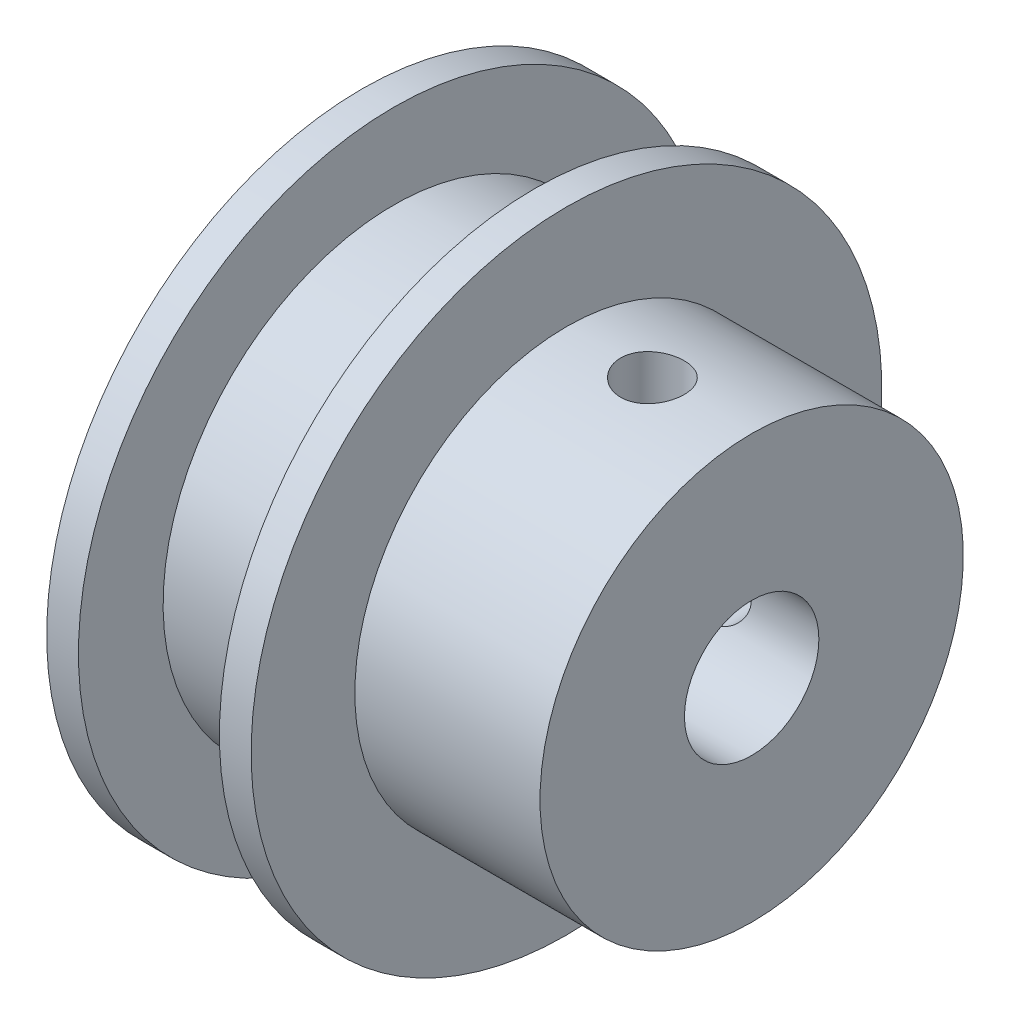
from build123d import *

# Parameters (mm, degrees)
CUT_EXTRUDE1_DEPTH      = 36.02253703
CUT_EXTRUDE1_DEPTH_BACK = 36.02253703
SKETCH4_R               = 3.175
CUT_EXTRUDE2_REACH      = 34.742
CUT_EXTRUDE2_END_RADIUS = 9.999999939
SKETCH5_R               = 1.5
CUT_EXTRUDE3_REACH      = 34.742
CUT_EXTRUDE3_END_RADIUS = 3.175
SKETCH8_R               = 1.5


with BuildPart() as part:
    # Sketch1 → Revolve1 (revolve)
    with BuildSketch(Plane.XY):
        Polygon((-3.33, 0), (3.33, 0), (3.33, 4), (4.83, 4), (4.83, -0.900000061), (13.58, -0.900000061), (13.58, -10.9), (-4.83, -10.9), (-4.83, 4), (-3.33, 4), align=None)
    revolve(axis=Axis((-4.83, -10.9, 0), (1, 0, 0)))

    # Sketch4 → Cut-Extrude1 (cut, two sides: drawn at the far end of the back side and taken through both)
    with BuildSketch(Plane(origin=(13.58, 0, 0), x_dir=(0, 0, -1), z_dir=(1, 0, 0)).offset(-CUT_EXTRUDE1_DEPTH_BACK)):
        with Locations((0, -10.9)):
            Circle(SKETCH4_R)
    extrude(amount=CUT_EXTRUDE1_DEPTH + CUT_EXTRUDE1_DEPTH_BACK, mode=Mode.SUBTRACT)

    # Cut-Extrude2: up to this cylinder (the profile starts inside it)
    cut_extrude2_end = Plane(origin=(8.89, -10.9, 0), z_dir=(-1, 0, 0)) * Cylinder(CUT_EXTRUDE2_END_RADIUS, 90.483999878, mode=Mode.PRIVATE)
    # Sketch5 → Cut-Extrude2 (cut, up to the surface)
    with BuildSketch(Plane.XY, mode=Mode.PRIVATE) as cut_extrude2_sk1:
        with Locations((8.89, -10.9)):
            Circle(SKETCH5_R)
    cut_extrude2_tool1 = extrude(cut_extrude2_sk1.sketch, amount=-CUT_EXTRUDE2_REACH, mode=Mode.PRIVATE) & cut_extrude2_end
    add(cut_extrude2_tool1.solids().sort_by_distance((8.89, -10.9, 0))[0], mode=Mode.SUBTRACT)

    # Cut-Extrude3: up to this cylinder (the profile starts outside it)
    cut_extrude3_end = Plane(origin=(8.89, -10.9, 0), z_dir=(1, 0, 0)) * Cylinder(CUT_EXTRUDE3_END_RADIUS, 76.834, mode=Mode.PRIVATE)
    # Sketch8 → Cut-Extrude3 (cut, up to the surface)
    with BuildSketch(Plane(origin=(0, 0, 0), x_dir=(1, 0, 0), z_dir=(0, 1, 0)), mode=Mode.PRIVATE) as cut_extrude3_sk1:
        with Locations((8.89, 0)):
            Circle(SKETCH8_R)
    cut_extrude3_tool1 = extrude(cut_extrude3_sk1.sketch, amount=-CUT_EXTRUDE3_REACH, mode=Mode.PRIVATE) - cut_extrude3_end
    add(cut_extrude3_tool1.solids().sort_by_distance((8.89, 0, 0))[0], mode=Mode.SUBTRACT)


solid = part.part
